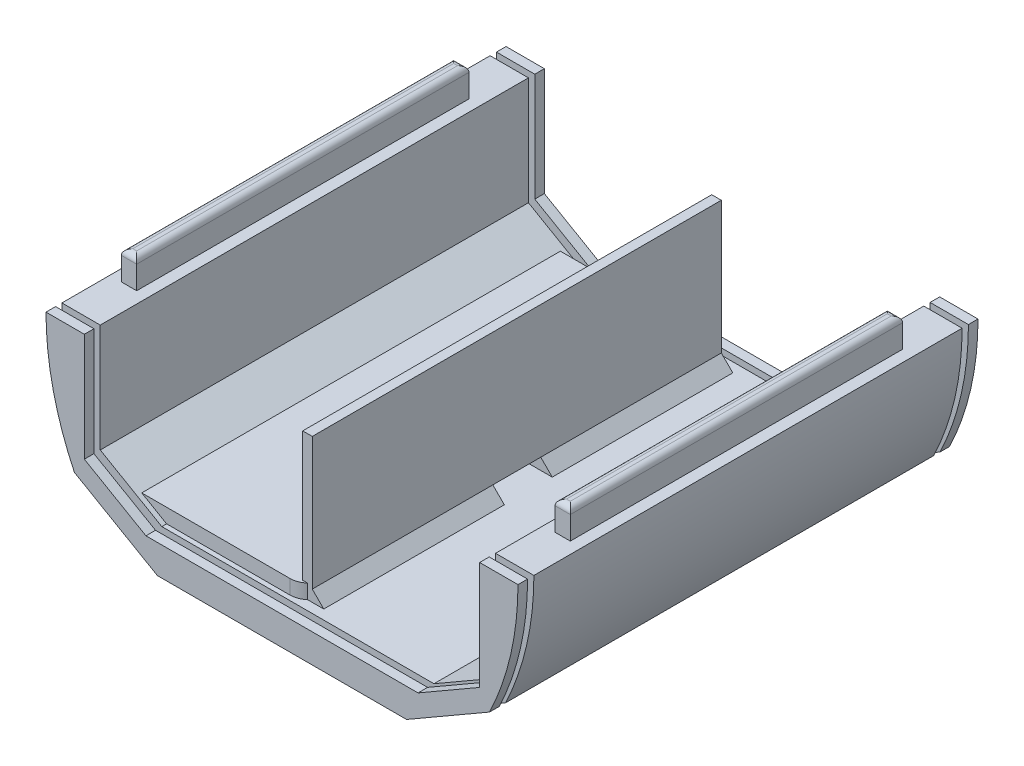
from build123d import *

# Parameters (mm, degrees)
BOSS_EXTRUDE1_DEPTH             = 240
CUT_EXTRUDE4_DEPTH              = 285.354710913
CUT_EXTRUDE4_DEPTH_BACK         = 285.354710913
CUT_EXTRUDE5_DEPTH              = 285.354710913
CUT_EXTRUDE5_DEPTH_BACK         = 285.354710913
SKETCH3_W                       = 3.3
SKETCH3_H                       = 170
BOSS_EXTRUDE4_REACH             = 286.355
SKETCH7_W                       = 213.4
SKETCH7_H                       = 5
BOSS_EXTRUDE4_DIRECTION_2_REACH = 286.355
CHAMFER7_SIZE                   = 6
SKETCH8_W                       = 5
SKETCH8_H                       = 213.4
BOSS_EXTRUDE5_DEPTH             = 120
CHAMFER8_SIZE                   = 6
CUT_EXTRUDE6_DEPTH              = 23
CUT_EXTRUDE6_DEPTH_BACK         = 176
SKETCH10_W                      = 25
SKETCH10_H                      = 6
BOSS_EXTRUDE6_DEPTH             = 90
FILLET1_R                       = 10
FILLET2_R                       = 10
SKETCH13_R                      = 1.2
CUT_EXTRUDE7_DEPTH              = 285.354710913
SKETCH14_R                      = 2
CUT_EXTRUDE8_DEPTH              = 47
CUT_EXTRUDE9_DEPTH              = 285.354710957
CUT_EXTRUDE9_DEPTH_BACK         = 285.354710957
SKETCH15_W                      = 272.433286574
SKETCH15_H                      = 99.158633553
SKETCH16_W                      = 8
SKETCH16_H                      = 173.4
BOSS_EXTRUDE7_DEPTH             = 15
FILLET3_R                       = 3


with BuildPart() as part:
    # Sketch1 → Boss-Extrude1 (new body)
    with BuildSketch(Plane.XY):
        with BuildLine():
            Line((-65, 90), (-108.301270189, 65))
            ThreePointArc((-108.301270189, 65), (-123.116211843, 0), (-108.301270189, -65))
            Line((-108.301270189, -65), (-65, -90))
            Line((-65, -90), (65, -90))
            Line((65, -90), (108.301270189, -65))
            ThreePointArc((108.301270189, -65), (123.116211843, 0), (108.301270189, 65))
            Line((108.301270189, 65), (65, 90))
            Line((65, 90), (-65, 90))
        make_face()
    extrude(amount=BOSS_EXTRUDE1_DEPTH)

    # Sketch2 → Cut-Extrude4 (cut, two sides: drawn at the far end of the back side and taken through both)
    with BuildSketch(Plane.XY.offset(240).offset(-CUT_EXTRUDE4_DEPTH_BACK)):
        Polygon((-70.980762114, 75), (70.980762114, 75), (103.116211843, 56.446589448), (103.116211843, -56.446589448), (70.980762114, -75), (-70.980762114, -75), (-103.116211843, -56.446589448), (-103.116211843, 56.446589448), align=None)
    extrude(amount=CUT_EXTRUDE4_DEPTH + CUT_EXTRUDE4_DEPTH_BACK, mode=Mode.SUBTRACT)

    # Sketch3 → Cut-Extrude5 (cut, two sides: drawn at the far end of the back side and taken through both)
    with BuildSketch(Plane(origin=(0, 0, 0), x_dir=(0, 0, -1), z_dir=(1, 0, 0)).offset(-CUT_EXTRUDE5_DEPTH_BACK)):
        with Locations((-233.35, 0)):
            Rectangle(SKETCH3_W, SKETCH3_H)
        with Locations((-6.65, 0)):
            Rectangle(SKETCH3_W, SKETCH3_H)
    extrude(amount=CUT_EXTRUDE5_DEPTH + CUT_EXTRUDE5_DEPTH_BACK, mode=Mode.SUBTRACT)

    # Boss-Extrude4: up to this face of the body (flat: up to its plane)
    boss_extrude4_end = Plane(part.part.faces().sort_by_distance((103.116211843, 0, 120))[0])
    # Sketch7 → Boss-Extrude4 (add, up to the picked face)
    with BuildSketch(Plane(origin=(0, 0, 0), x_dir=(0, 0, -1), z_dir=(1, 0, 0)), mode=Mode.PRIVATE) as boss_extrude4_sk1:
        with Locations((-120, 47.5)):
            Rectangle(SKETCH7_W, SKETCH7_H)
    boss_extrude4_tool1 = split(extrude(boss_extrude4_sk1.sketch, amount=BOSS_EXTRUDE4_REACH, mode=Mode.PRIVATE), bisect_by=boss_extrude4_end, keep=Keep.BOTH, mode=Mode.PRIVATE)
    add(boss_extrude4_tool1.solids().sort_by(Axis((0, 47.5, 120), (1, 0, 0)))[0])

    # Boss-Extrude4 direction 2: up to this face of the body (flat: up to its plane)
    boss_extrude4_direction_2_end = Plane(part.part.faces().sort_by_distance((-103.116211843, 0, 120))[0])
    # Sketch7 → Boss-Extrude4 direction 2 (add, up to the picked face)
    with BuildSketch(Plane(origin=(0, 0, 0), x_dir=(0, 0, -1), z_dir=(1, 0, 0)), mode=Mode.PRIVATE) as boss_extrude4_direction_2_sk1:
        with Locations((-120, 47.5)):
            Rectangle(SKETCH7_W, SKETCH7_H)
    boss_extrude4_direction_2_tool1 = split(extrude(boss_extrude4_direction_2_sk1.sketch, amount=-BOSS_EXTRUDE4_DIRECTION_2_REACH, mode=Mode.PRIVATE), bisect_by=boss_extrude4_direction_2_end, keep=Keep.BOTH, mode=Mode.PRIVATE)
    add(boss_extrude4_direction_2_tool1.solids().sort_by(Axis((0, 47.5, 120), (-1, 0, 0)))[0])

    # Chamfer7
    chamfer7_edges = [part.edges().sort_by_distance(p)[0] for p in [
        (-103.116211843, 45, 120),
        (103.116211843, 45, 120),
    ]]
    chamfer(chamfer7_edges, length=CHAMFER7_SIZE)

    # Sketch8 → Boss-Extrude5 (add)
    with BuildSketch(Plane(origin=(0, -75, 0), x_dir=(1, 0, 0), z_dir=(0, 1, 0))):
        with Locations((0, -120)):
            Rectangle(SKETCH8_W, SKETCH8_H)
    extrude(amount=BOSS_EXTRUDE5_DEPTH)

    # Chamfer8
    chamfer8_edges = [part.edges().sort_by_distance(p)[0] for p in [
        (2.5, -75, 120),
        (-2.5, -75, 120),
        (2.5, 45, 120),
        (-2.5, 45, 120),
    ]]
    chamfer(chamfer8_edges, length=CHAMFER8_SIZE)

    # Sketch10 → Cut-Extrude6 (cut, two sides: drawn at the far end of the back side and taken through both)
    with BuildSketch(Plane(origin=(0, 0, 0), x_dir=(0, 0, -1), z_dir=(1, 0, 0)).offset(-CUT_EXTRUDE6_DEPTH_BACK)):
        with Locations((-120, -72)):
            Rectangle(SKETCH10_W, SKETCH10_H)
    extrude(amount=CUT_EXTRUDE6_DEPTH + CUT_EXTRUDE6_DEPTH_BACK, mode=Mode.SUBTRACT)

    # Sketch12 → Boss-Extrude6 (add)
    with BuildSketch(Plane(origin=(0, 0, 0), x_dir=(0, 0, -1), z_dir=(1, 0, 0))):
        Polygon((-10.8, -67.5), (-229.2, -67.5), (-229.2, -75), (-132.5, -75), (-132.5, -69), (-107.5, -69), (-107.5, -75), (-10.8, -75), align=None)
    extrude(amount=-BOSS_EXTRUDE6_DEPTH)

    # Fillet1
    # the kernel refuses this fillet: 10 mm, written as the material it takes off along each edge
    with BuildSketch(Plane(origin=(0, -75, 10.8), x_dir=(-1, 0, 0), z_dir=(0, 1, 0))) as fillet1_piece_1:
        with BuildLine():
            CenterArc((6.614378278, 10), FILLET1_R, 228.590377891, 41.409622109)
            Line((0, 2.5), (-0.132287566, 2.35))
            ThreePointArc((-0.132287566, 2.35), (-0.2, 1.25), (-0.2, 0))
            Line((-0.2, 0), (0, -0.2))
            Line((0, -0.2), (6.614378278, -0.2))
            Line((6.614378278, -0.2), (6.614378278, 0))
        make_face()
    extrude(amount=24.035945694, mode=Mode.SUBTRACT)

    # Fillet2
    # the kernel refuses this fillet: 10 mm, written as the material it takes off along each edge
    with BuildSketch(Plane(origin=(0, -50.964054306, 229.2), x_dir=(0, 0, -1), z_dir=(0, -1, 0))) as fillet2_piece_1:
        with BuildLine():
            CenterArc((10, -6.614378278), FILLET2_R, 138.590377891, 41.409622109)
            Line((0, -6.614378278), (-0.2, -6.614378278))
            Line((-0.2, -6.614378278), (-0.2, 0))
            Line((-0.2, 0), (0, 0.2))
            ThreePointArc((0, 0.2), (1.25, 0.2), (2.35, 0.132287566))
            Line((2.35, 0.132287566), (2.5, 0))
        make_face()
    extrude(amount=24.035945694, mode=Mode.SUBTRACT)

    # Sketch13 → Cut-Extrude7 (cut, through all)
    with BuildSketch(Plane(origin=(0, 0, 0), x_dir=(0, 0, -1), z_dir=(1, 0, 0))):
        with Locations((-173.35, 62.5)):
            Circle(SKETCH13_R)
        with Locations((-66.65, 62.5)):
            Circle(SKETCH13_R)
    extrude(amount=-CUT_EXTRUDE7_DEPTH, mode=Mode.SUBTRACT)

    # Sketch14 → Cut-Extrude8 (cut)
    with BuildSketch(Plane(origin=(0, 50, 0), x_dir=(1, 0, 0), z_dir=(0, 1, 0))):
        with Locations(Location((-41.18, -120, 0), (0, 0, 270))):
            Circle(SKETCH14_R)
    extrude(amount=-CUT_EXTRUDE8_DEPTH, mode=Mode.SUBTRACT)

    # Sketch15 → Cut-Extrude9 (cut, two sides: drawn at the far end of the back side and taken through both)
    with BuildSketch(Plane.XY.offset(-CUT_EXTRUDE9_DEPTH_BACK)):
        with Locations((1.391256338, 49.579316777)):
            Rectangle(SKETCH15_W, SKETCH15_H)
    extrude(amount=CUT_EXTRUDE9_DEPTH + CUT_EXTRUDE9_DEPTH_BACK, mode=Mode.SUBTRACT)

    # Sketch16 → Boss-Extrude7 (add)
    with BuildSketch(Plane(origin=(0, 0, 0), x_dir=(1, 0, 0), z_dir=(0, 1, 0))):
        with Locations((-113.116211843, -120)):
            Rectangle(SKETCH16_W, SKETCH16_H)
        with Locations((113.116211843, -120)):
            Rectangle(SKETCH16_W, SKETCH16_H)
    extrude(amount=BOSS_EXTRUDE7_DEPTH)

    # Fillet3
    fillet3_edges = [part.edges().sort_by_distance(p)[0] for p in [
        (-117.116211843, 15, 120),
        (-113.116211843, 15, 206.7),
        (-109.116211843, 15, 120),
        (-113.116211843, 15, 33.3),
        (109.116211843, 15, 120),
        (113.116211843, 15, 206.7),
        (117.116211843, 15, 120),
        (113.116211843, 15, 33.3),
    ]]
    fillet(fillet3_edges, radius=FILLET3_R)


solid = part.part
